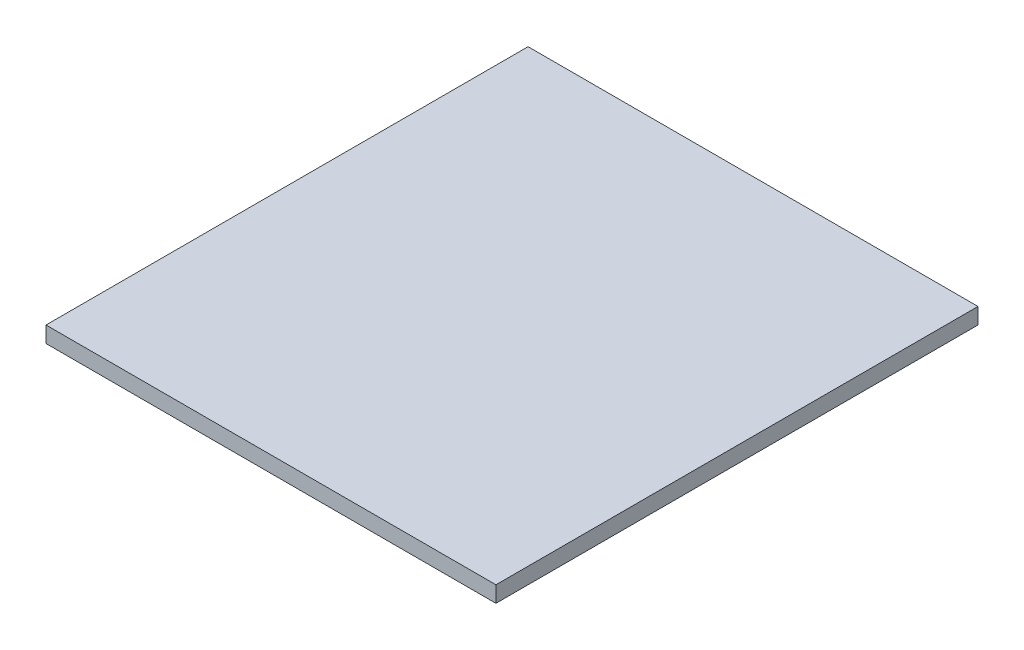
from build123d import *

# Parameters (mm, degrees)
SKETCH_1_W        = 280
SKETCH_1_H        = 300
EXTRUDE_321_DEPTH = 10


with BuildPart() as part:
    # Эскиз1 → Extrude 321 (new body)
    with BuildSketch(Plane(origin=(0, 0, 0), x_dir=(1, 0, 0), z_dir=(0, 1, 0))):
        with Locations((140, 150)):
            Rectangle(SKETCH_1_W, SKETCH_1_H)
    extrude(amount=EXTRUDE_321_DEPTH)


solid = part.part
